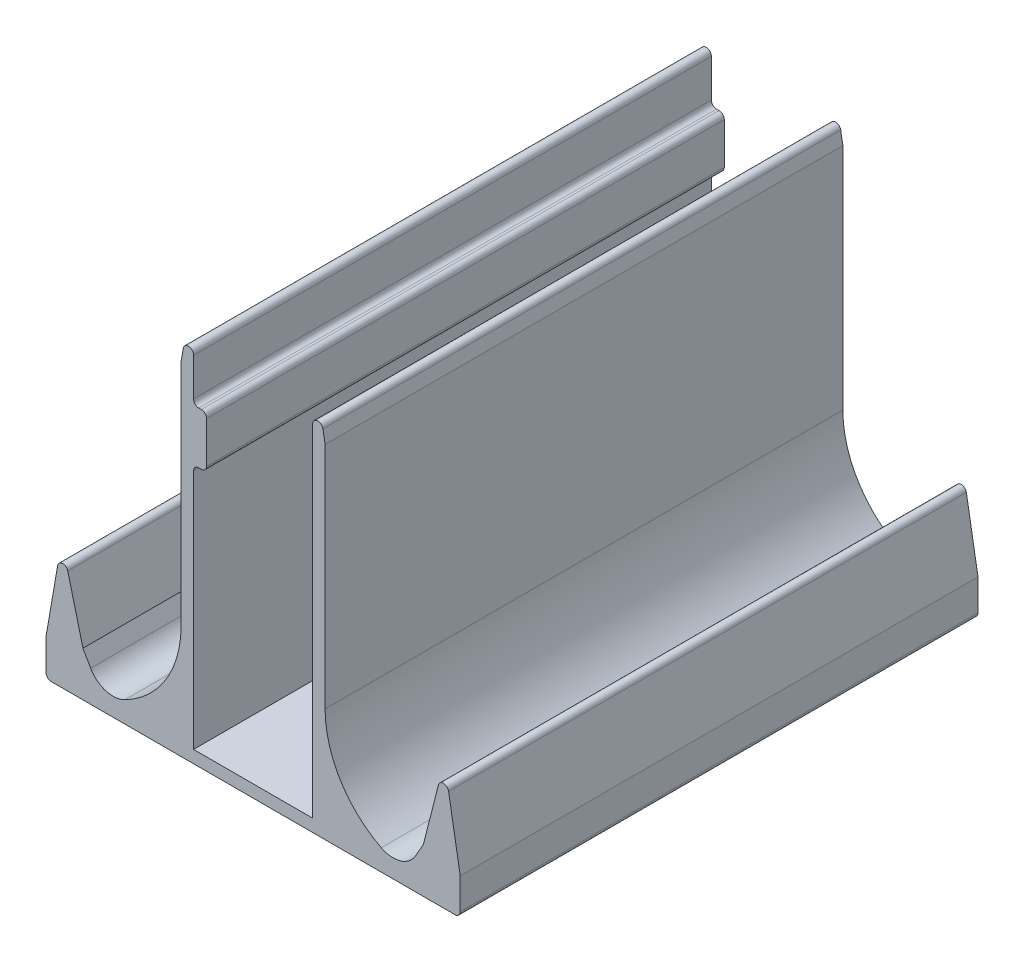
from build123d import *

# Parameters (mm, degrees)
BOSS_EXTRU_1_DEPTH = 100
CONG_2_R           = 1
CONGES_BASE_R      = 20
CONG_4_R           = 1
CONG_5_R           = 5


with BuildPart() as part:
    # Esquisse1 → Boss.-Extru.1 (new body)
    with BuildSketch(Plane.XY):
        Polygon((-11.5, 2.4), (11.5, 2.4), (11.5, 80), (13.9, 66.111581736), (13.9, 2.4), (29.296036477, 2.4), (32.866170168, 8.646815683), (36.954561628, 24.631379819), (40, 7.007912357), (40, 0), (-40, 0), (-40, 7.007912357), (-36.954561628, 24.631379819), (-32.866170168, 8.646815683), (-29.296036477, 2.4), (-13.9, 2.4), (-13.9, 66.111581736), (-11.5, 80), (-11.5, 60), (-9, 60), (-9, 50), (-11.5, 50), align=None)
    extrude(amount=BOSS_EXTRU_1_DEPTH)

    # Congé2
    cong_2_edges = [part.edges().sort_by_distance(p)[0] for p in [
        (-11.5, 60, 50),
        (-9, 60, 50),
        (-9, 50, 50),
        (-11.5, 50, 50),
    ]]
    fillet(cong_2_edges, radius=CONG_2_R)

    # Conges_base
    # the kernel refuses this fillet: 20 mm, written as the material it adds along each edge
    with BuildSketch(Plane(origin=(13.9, 2.4, 0), x_dir=(0, 1, 0), z_dir=(0, 0, 1))) as conges_base_piece_1:
        with BuildLine():
            CenterArc((19.462875427, -20), CONGES_BASE_R, 90, 76.691260518)
            Line((0, -15.396036477), (-0.389257509, -15.303957207))
            ThreePointArc((-0.389257509, -15.303957207), (-0.4, -7.698018239), (-0.4, 0))
            Line((-0.4, 0), (0, 0.4))
            Line((0, 0.4), (19.462875427, 0.4))
            Line((19.462875427, 0.4), (19.462875427, 0))
        make_face()
    extrude(amount=100)
    with BuildSketch(Plane(origin=(-13.9, 2.4, 0), x_dir=(0, 1, 0), z_dir=(0, 0, 1))) as conges_base_piece_2:
        with BuildLine():
            CenterArc((19.462875427, 20), CONGES_BASE_R, 193.308739482, 76.691260518)
            Line((0, 15.396036477), (-0.389257509, 15.303957207))
            ThreePointArc((-0.389257509, 15.303957207), (-0.4, 7.698018239), (-0.4, 0))
            Line((-0.4, 0), (0, -0.4))
            Line((0, -0.4), (19.462875427, -0.4))
            Line((19.462875427, -0.4), (19.462875427, 0))
        make_face()
    extrude(amount=100)

    # Congé4
    cong_4_edges = [part.edges().sort_by_distance(p)[0] for p in [
        (11.5, 80, 50),
        (36.954561628, 24.631379819, 50),
        (40, 0, 50),
        (-40, 0, 50),
        (-36.954561628, 24.631379819, 50),
        (-11.5, 80, 50),
    ]]
    fillet(cong_4_edges, radius=CONG_4_R)

    # Congé5
    cong_5_edges = [part.edges().sort_by_distance(p)[0] for p in [
        (29.296036477, 2.4, 50),
        (-29.296036477, 2.4, 50),
    ]]
    fillet(cong_5_edges, radius=CONG_5_R)


solid = part.part
